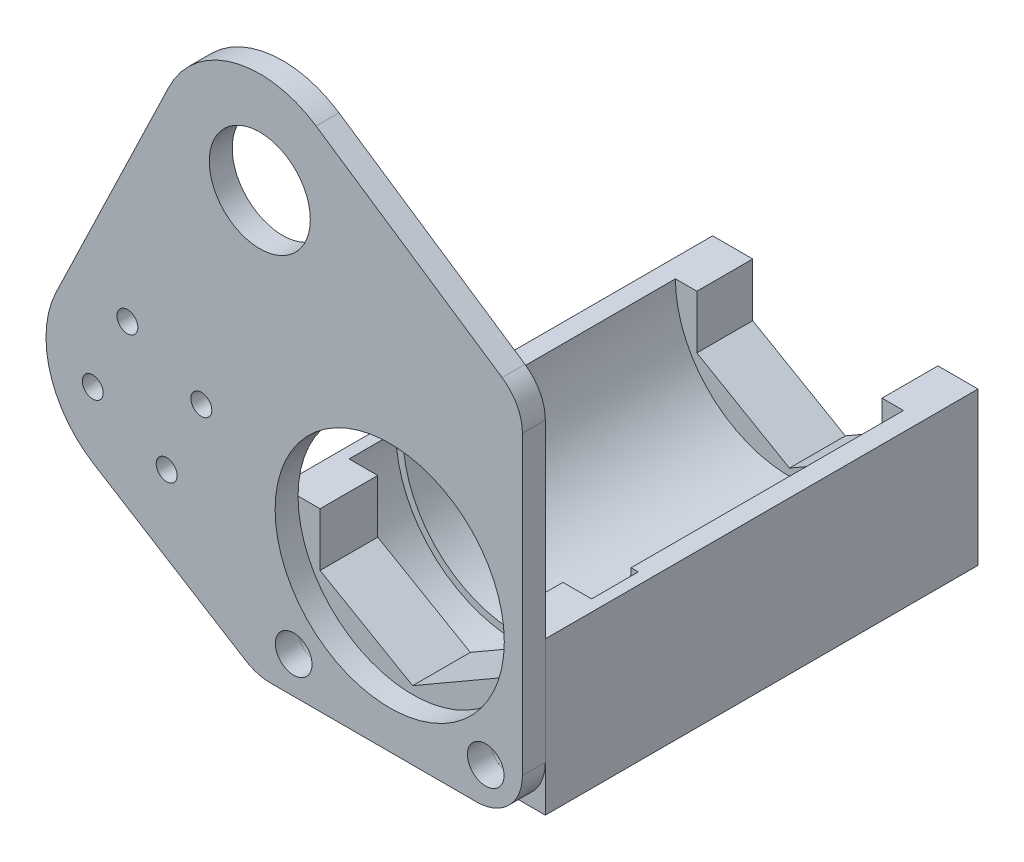
from build123d import *

# Parameters (mm, degrees)
SKETCH1_R                        = 2.54
BOSS_EXTRUDE1_DEPTH              = 7.992618
BOSS_EXTRUDE2_START              = -7.992618
SKETCH1_3_R                      = 2.54
BOSS_EXTRUDE2_DEPTH              = 6.477
BOSS_EXTRUDE4_START              = -59.944
SKETCH1_5_R                      = 2.54
BOSS_EXTRUDE4_DEPTH              = 7.738618
BOSS_EXTRUDE3_START              = -14.469618
SKETCH1_4_R                      = 2.54
BOSS_EXTRUDE3_DEPTH              = 37.735764
SKETCH2_R                        = 2.54
SKETCH2_R_2                      = 15.875
SKETCH2_R_3                      = 7
BOSS_EXTRUDE5_DEPTH              = 3.175
SKETCH3_W                        = 1.45
SKETCH3_H                        = 3.175
M3_5X0_6_TAPPED_HOLE1_AT_2_COUNT = 2
M3_5X0_6_TAPPED_HOLE1_AT_2_PITCH = 11.313708499
M3_5X0_6_TAPPED_HOLE1_AT_3_COUNT = 2
M3_5X0_6_TAPPED_HOLE1_AT_3_PITCH = 16
M3_5X0_6_TAPPED_HOLE1_AT_4_COUNT = 2
M3_5X0_6_TAPPED_HOLE1_AT_4_PITCH = 11.313708499
FILLET1_R                        = 6.35


with BuildPart() as part:
    # Sketch1 → Boss-Extrude1 (new body)
    with BuildSketch(Plane.XY):
        Polygon((-12.827, -7.405671903), (-12.827, 0), (-18.38325, 0), (-18.38325, -21.161343806), (18.38325, -21.161343806), (18.38325, 0), (12.827, 0), (12.827, -7.405671903), (0, -14.811343806), align=None)
        with Locations((13.30325, -16.081343806)):
            Circle(SKETCH1_R, mode=Mode.SUBTRACT)
        with Locations((-13.30325, -16.081343806)):
            Circle(SKETCH1_R, mode=Mode.SUBTRACT)
    extrude(amount=-BOSS_EXTRUDE1_DEPTH)

    # Sketch1<3> → Boss-Extrude2 (add)
    with BuildSketch(Plane.XY.offset(BOSS_EXTRUDE2_START)):
        with BuildLine():
            ThreePointArc((16.79575, 0), (0, -16.79575), (-16.79575, 0))
            Line((-16.79575, 0), (-18.38325, 0))
            Line((-18.38325, 0), (-18.38325, -21.161343806))
            Line((-18.38325, -21.161343806), (18.38325, -21.161343806))
            Line((18.38325, -21.161343806), (18.38325, 0))
            Line((18.38325, 0), (16.79575, 0))
        make_face()
        with Locations((-13.30325, -16.081343806)):
            Circle(SKETCH1_3_R, mode=Mode.SUBTRACT)
        with Locations((13.30325, -16.081343806)):
            Circle(SKETCH1_3_R, mode=Mode.SUBTRACT)
    extrude(amount=-BOSS_EXTRUDE2_DEPTH)

    # Sketch1<4> → Boss-Extrude3 (add)
    with BuildSketch(Plane.XY.offset(BOSS_EXTRUDE3_START)):
        with BuildLine():
            ThreePointArc((15.7988, 0), (0, -15.7988), (-15.7988, 0))
            Line((-15.7988, 0), (-18.38325, 0))
            Line((-18.38325, 0), (-18.38325, -21.161343806))
            Line((-18.38325, -21.161343806), (18.38325, -21.161343806))
            Line((18.38325, -21.161343806), (18.38325, 0))
            Line((18.38325, 0), (15.7988, 0))
        make_face()
        with Locations((13.30325, -16.081343806)):
            Circle(SKETCH1_4_R, mode=Mode.SUBTRACT)
        with Locations((-13.30325, -16.081343806)):
            Circle(SKETCH1_4_R, mode=Mode.SUBTRACT)
    extrude(amount=-BOSS_EXTRUDE3_DEPTH)


with BuildPart() as body_2:
    # Sketch1<5> → Boss-Extrude4 (new body)
    with BuildSketch(Plane.XY.offset(BOSS_EXTRUDE4_START)):
        Polygon((-12.827, -7.405671903), (-12.827, 0), (-18.38325, 0), (-18.38325, -21.161343806), (18.38325, -21.161343806), (18.38325, 0), (12.827, 0), (12.827, -7.405671903), (0, -14.811343806), align=None)
        with Locations((13.30325, -16.081343806)):
            Circle(SKETCH1_5_R, mode=Mode.SUBTRACT)
        with Locations((-13.30325, -16.081343806)):
            Circle(SKETCH1_5_R, mode=Mode.SUBTRACT)
    extrude(amount=BOSS_EXTRUDE4_DEPTH)


with BuildPart() as part_1:
    add(part.part)

    # Combine1: union body 2
    add(body_2.part)


with BuildPart() as body_2_2:
    # Sketch2 → Boss-Extrude5 (new body)
    with BuildSketch(Plane.XY):
        with BuildLine():
            Line((18.38325, -21.161343806), (-18.38325, -21.161343806))
            Line((-18.38325, -21.161343806), (-41.001883978, -7.126958523))
            ThreePointArc((-41.001883978, -7.126958523), (-47.06048262, 0.853254126), (-46.231666072, 10.838416846))
            Line((-46.231666072, 10.838416846), (-30.608416072, 43.271641469))
            ThreePointArc((-30.608416072, 43.271641469), (-21.67147957, 50.702926717), (-10.202170361, 48.819371375))
            Line((-10.202170361, 48.819371375), (18.38325, 29.638656194))
            Line((18.38325, 29.638656194), (18.38325, -21.161343806))
        make_face()
        with Locations((-13.30325, -16.081343806)):
            Circle(SKETCH2_R, mode=Mode.SUBTRACT)
        with Locations(Location((13.30325, -16.081343806, 0), (0, 0, 180))):
            Circle(SKETCH2_R, mode=Mode.SUBTRACT)
        with Locations((0, -0.019646968)):
            Circle(SKETCH2_R_2, mode=Mode.SUBTRACT)
        with Locations((-18, 37.198103032)):
            Circle(SKETCH2_R_3, mode=Mode.SUBTRACT)
    extrude(amount=BOSS_EXTRUDE5_DEPTH)

    # Sketch3 → M3.5x0.6 Tapped Hole1 (revolve, cut)
    with BuildSketch(Plane(origin=(-26.099885072, 7.484985053, 0), x_dir=(0, 1, 0), z_dir=(1, 0, 0))):
        with Locations((0.725, 1.5875)):
            Rectangle(SKETCH3_W, SKETCH3_H)
    m3_5x0_6_tapped_hole1 = revolve(axis=Axis((-26.099885072, 7.484985053, -6.35), (0, 0, 1)), mode=Mode.SUBTRACT)

    # M3.5x0.6 Tapped Hole1 at 2: M3.5x0.6 Tapped Hole1 ×2
    with Locations(*[Vector(-0.9054035264513098, 0.4245520631083216, 0) * (i * M3_5X0_6_TAPPED_HOLE1_AT_2_PITCH) for i in range(1, M3_5X0_6_TAPPED_HOLE1_AT_2_COUNT)]):
        add(m3_5x0_6_tapped_hole1, mode=Mode.SUBTRACT)

    # M3.5x0.6 Tapped Hole1 at 3: M3.5x0.6 Tapped Hole1 ×2
    with Locations(*[Vector(-0.9404206160545683, -0.34001333047330123, 0) * (i * M3_5X0_6_TAPPED_HOLE1_AT_3_PITCH) for i in range(1, M3_5X0_6_TAPPED_HOLE1_AT_3_COUNT)]):
        add(m3_5x0_6_tapped_hole1, mode=Mode.SUBTRACT)

    # M3.5x0.6 Tapped Hole1 at 4: M3.5x0.6 Tapped Hole1 ×2
    with Locations(*[Vector(-0.42455206310832183, -0.9054035264513097, 0) * (i * M3_5X0_6_TAPPED_HOLE1_AT_4_PITCH) for i in range(1, M3_5X0_6_TAPPED_HOLE1_AT_4_COUNT)]):
        add(m3_5x0_6_tapped_hole1, mode=Mode.SUBTRACT)

    # Fillet1
    fillet1_edges = [body_2_2.edges().sort_by_distance(p)[0] for p in [
        (18.38325, -21.161343806, 1.5875),
        (-18.38325, -21.161343806, 1.5875),
        (18.38325, 29.638656194, 1.5875),
    ]]
    fillet(fillet1_edges, radius=FILLET1_R)


solid = Compound([part_1.part, body_2_2.part])
